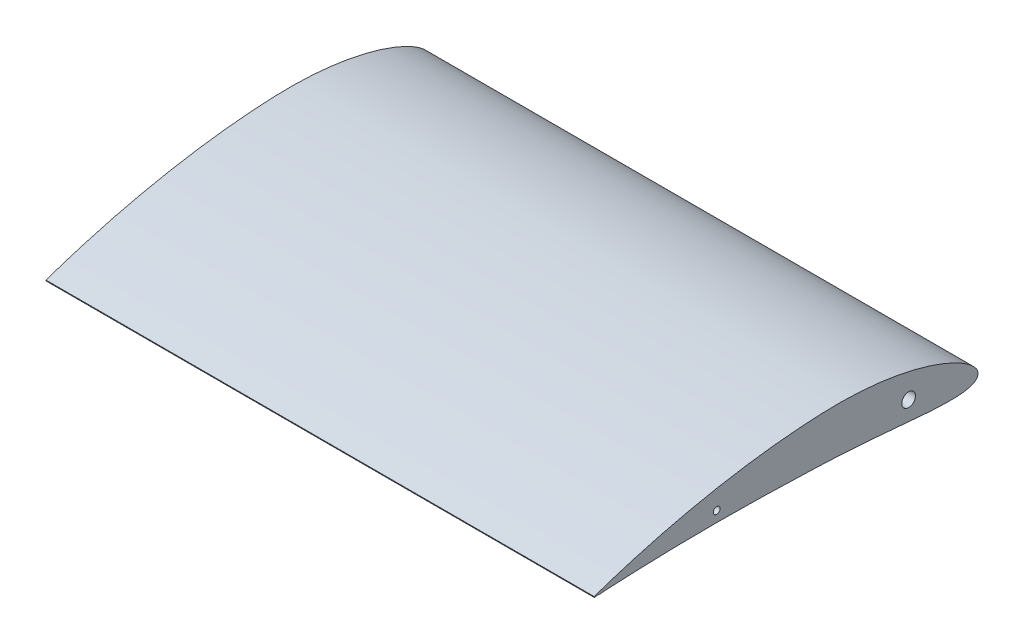
from build123d import *

# Parameters (mm, degrees)
BOSS_EXTRUDE1_DEPTH      = 254
BOSS_EXTRUDE1_DEPTH_BACK = 254
SKETCH2_R                = 6.35
CUT_EXTRUDE1_DEPTH       = 101.6
SKETCH3_R                = 3.175
CUT_EXTRUDE2_DEPTH       = 127


with BuildPart() as part:
    # Sketch1 → Boss-Extrude1 (new, two sides: drawn at the far end of the back side and taken through both)
    with BuildSketch(Plane(origin=(0, 0, 0), x_dir=(0, 0, -1), z_dir=(1, 0, 0)).offset(-BOSS_EXTRUDE1_DEPTH_BACK)):
        with BuildLine():
            Line((-354.787327228, -0.030257196), (-354.876173011, 0.410417887))
            add(Edge.make_bspline(
                [(-354.876173011, 0.410417887), (-354.559877309, 0.519388), (-353.29965963, 0.95355787), (-350.47872665, 1.927095868), (-345.800950265, 3.497798274), (-336.024074692, 6.721551148), (-319.654473712, 11.798891927), (-300.598349456, 17.130600639), (-282.422876264, 21.724272526), (-261.175777938, 26.651569731), (-238.622276389, 31.145528798), (-208.774809213, 36.004755717), (-183.96165787, 39.090454058), (-158.902335219, 41.113212891), (-140.096691022, 42.111376668), (-121.516747473, 42.228858195), (-103.422167262, 41.321050632), (-86.188408528, 39.478676181), (-70.043450957, 36.810480574), (-55.199760436, 33.432905997), (-41.843390777, 29.510854383), (-30.130463623, 25.220125297), (-20.187014188, 20.73431935), (-12.107203154, 16.226289935), (-5.926897661, 11.855341958), (-1.679224073, 7.716499794), (0.765838065, 3.796757813), (0.987487677, -0.148325216), (-1.35108726, -3.308943186), (-5.450780885, -5.288085739), (-11.087315968, -6.587464624), (-18.34911979, -7.268527656), (-27.163826626, -7.404874951), (-37.447057223, -7.053797092), (-49.083078017, -6.301866785), (-61.95239395, -5.238034817), (-75.929862643, -3.983911698), (-96.406736552, -2.153555858), (-117.937239158, -0.458414508), (-140.484776897, 0.674535203), (-158.296467959, 1.286744043), (-176.48388462, 1.917893193), (-200.671973719, 2.586246563), (-224.541124114, 2.979106232), (-247.830237405, 3.028480659), (-264.337268621, 2.907447598), (-279.933149694, 2.656365926), (-294.437996632, 2.282890374), (-307.681856469, 1.852126627), (-319.513378006, 1.371074809), (-329.767358246, 0.912902227), (-338.388880463, 0.426846955), (-345.076973543, 0.191518705), (-350.227621538, -0.406394891), (-352.780150329, -0.035387827), (-354.744619464, -0.75811662), (-354.777220059, -0.20251155), (-354.787327228, -0.030257196)],
                knots=[0, 0, 0, 0, 0.001371577, 0.005464776, 0.012234802, 0.021601969, 0.04767125, 0.082496261, 0.102719149, 0.124527079, 0.171912573, 0.19697838, 0.248496767, 0.274385101, 0.300041178, 0.325689988, 0.350525088, 0.374279703, 0.396711254, 0.417576734, 0.436654006, 0.45374439, 0.468679994, 0.481329415, 0.491630702, 0.499615789, 0.505546281, 0.510184984, 0.514824194, 0.520701508, 0.52851604, 0.538465752, 0.550542609, 0.564643256, 0.580638139, 0.598344876, 0.617584458, 0.638174401, 0.682632113, 0.706120665, 0.730727383, 0.755700244, 0.780731769, 0.829932396, 0.853570292, 0.876213105, 0.897609987, 0.917519394, 0.935698347, 0.951942678, 0.966047159, 0.97783994, 0.987174002, 0.993931501, 0.998018399, 0.999385644, 1, 1, 1, 1], degree=3))
        make_face()
    extrude(amount=BOSS_EXTRUDE1_DEPTH + BOSS_EXTRUDE1_DEPTH_BACK)

    # Sketch2 → Cut-Extrude1 (cut)
    with BuildSketch(Plane.ZY.offset(254)):
        with Locations((63.5, 12.7)):
            Circle(SKETCH2_R)
    cut_extrude1 = extrude(amount=-CUT_EXTRUDE1_DEPTH, mode=Mode.SUBTRACT)

    # Mirror1: Cut-Extrude1 across plane
    add(cut_extrude1.mirror(Plane(origin=(0, 0, 0), x_dir=(0, 0, 1), z_dir=(1, 0, 0))), mode=Mode.SUBTRACT)

    # Sketch3 → Cut-Extrude2 (cut)
    with BuildSketch(Plane.ZY.offset(254)):
        with Locations((241.3, 12.7)):
            Circle(SKETCH3_R)
    cut_extrude2 = extrude(amount=-CUT_EXTRUDE2_DEPTH, mode=Mode.SUBTRACT)

    # Mirror2: Cut-Extrude2 across plane
    add(cut_extrude2.mirror(Plane(origin=(0, 0, 0), x_dir=(0, 0, 1), z_dir=(1, 0, 0))), mode=Mode.SUBTRACT)


solid = part.part
